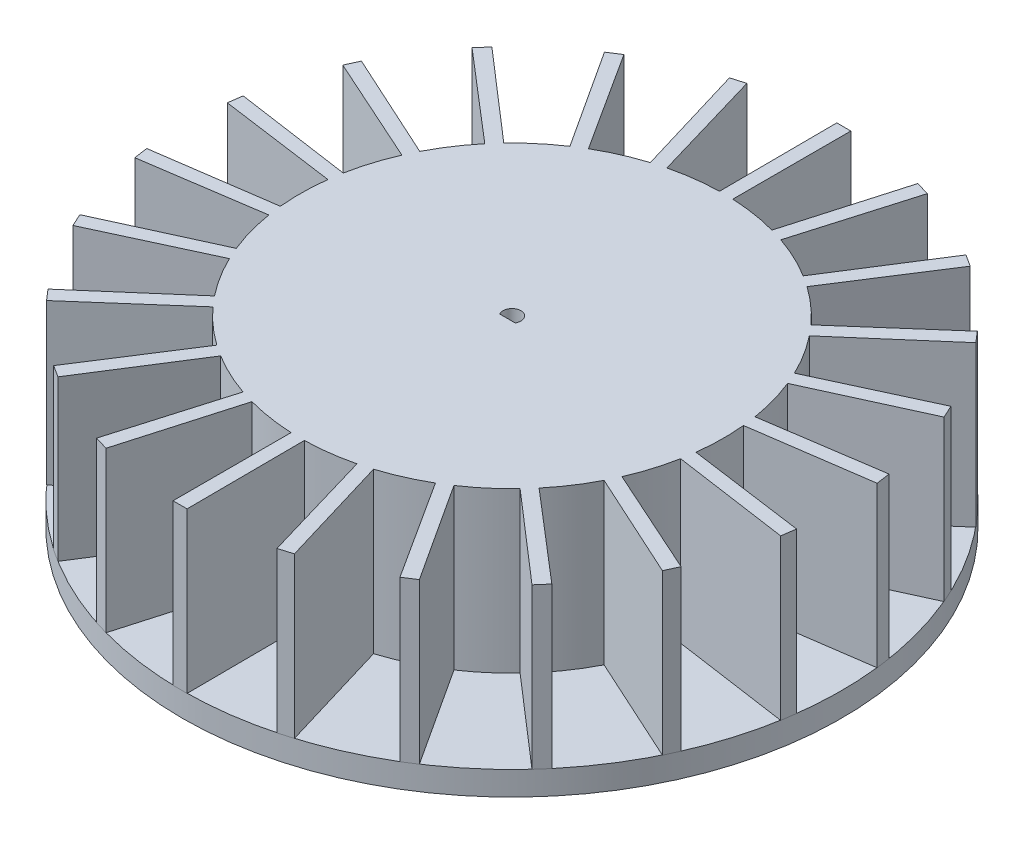
from build123d import *

# Parameters (mm, degrees)
SKETCH1_R           = 82.5
BOSS_EXTRUDE1_DEPTH = 6
BOSS_EXTRUDE3_DEPTH = 40
SKETCH14_R          = 36
CUT_EXTRUDE1_DEPTH  = 36
CUT_EXTRUDE2_DEPTH  = 36


with BuildPart() as part:
    # Sketch1 → Boss-Extrude1 (new body)
    with BuildSketch(Plane(origin=(0, 0, 0), x_dir=(1, 0, 0), z_dir=(0, 1, 0))):
        Circle(SKETCH1_R)
    extrude(amount=BOSS_EXTRUDE1_DEPTH)


with BuildPart() as body_2:
    # Sketch2 → Boss-Extrude3 (new body)
    with BuildSketch(Plane(origin=(0, 6, 0), x_dir=(1, 0, 0), z_dir=(0, 1, 0))):
        with BuildLine():
            Line((-25.48785652, -78.499002166), (-22.108464136, -79.4912813))
            Line((-22.108464136, -79.4912813), (-13.945902175, -51.132297157))
            ThreePointArc((-13.945902175, -51.132297157), (-8.193269273, -52.362871757), (-2.339694653, -52.948331692))
            Line((-2.339694653, -52.948331692), (-2.339694653, -82.5))
            Line((-2.339694653, -82.5), (1.182365931, -82.5))
            Line((1.182365931, -82.5), (1.024637667, -52.990094524))
            ThreePointArc((1.024637667, -52.990094524), (6.890941446, -52.55011823), (12.672348288, -51.46272038))
            Line((12.672348288, -51.46272038), (20.998015359, -79.81733848))
            Line((20.998015359, -79.81733848), (24.377407743, -78.825059346))
            Line((24.377407743, -78.825059346), (15.91216746, -50.554949577))
            ThreePointArc((15.91216746, -50.554949577), (21.41688907, -48.480066652), (26.657752936, -45.807905523))
            Line((26.657752936, -45.807905523), (42.634591047, -70.668350889))
            Line((42.634591047, -70.668350889), (45.597536957, -68.764181175))
            Line((45.597536957, -68.764181175), (29.510588078, -44.024143277))
            ThreePointArc((29.510588078, -44.024143277), (34.207767713, -40.482448396), (38.483504981, -36.442006591))
            Line((38.483504981, -36.442006591), (60.817165726, -55.794233789))
            Line((60.817165726, -55.794233789), (63.123624906, -53.132438001))
            Line((63.123624906, -53.132438001), (40.718236356, -33.926762711))
            ThreePointArc((40.718236356, -33.926762711), (44.227336457, -29.205182929), (47.191552323, -24.123793014))
            Line((47.191552323, -24.123793014), (74.072695332, -36.399999689))
            Line((74.072695332, -36.399999689), (75.535812176, -33.196220691))
            Line((75.535812176, -33.196220691), (48.627135286, -21.0808376))
            ThreePointArc((48.627135286, -21.0808376), (50.663869432, -15.561887231), (52.076420754, -9.851213197))
            Line((52.076420754, -9.851213197), (81.327295689, -14.056854093))
            Line((81.327295689, -14.056854093), (81.828537171, -10.570643006))
            Line((81.828537171, -10.570643006), (52.596552911, -6.527068399))
            ThreePointArc((52.596552911, -6.527068399), (52.995917015, -0.65785998), (52.742367286, 5.219453326))
            Line((52.742367286, 5.219453326), (81.993242221, 9.425094222))
            Line((81.993242221, 9.425094222), (81.492000739, 12.911305309))
            Line((81.492000739, 12.911305309), (52.304910623, 8.555485065))
            ThreePointArc((52.304910623, 8.555485065), (51.03455058, 14.299463175), (49.135440892, 19.867270782))
            Line((49.135440892, 19.867270782), (76.016583902, 32.143477457))
            Line((76.016583902, 32.143477457), (74.553467058, 35.347256454))
            Line((74.553467058, 35.347256454), (47.775835546, 22.944924011))
            ThreePointArc((47.775835546, 22.944924011), (44.938668372, 28.098328865), (41.547853297, 32.905560114))
            Line((41.547853297, 32.905560114), (63.881514042, 52.257787312))
            Line((63.881514042, 52.257787312), (61.575054863, 54.9195831))
            Line((61.575054863, 54.9195831), (39.376246407, 35.475501673))
            ThreePointArc((39.376246407, 35.475501673), (35.202122512, 39.620835057), (30.594305722, 43.278036663))
            Line((30.594305722, 43.278036663), (46.571143833, 68.138482029))
            Line((46.571143833, 68.138482029), (43.608197923, 70.042651742))
            Line((43.608197923, 70.042651742), (27.786627963, 45.132065169))
            ThreePointArc((27.786627963, 45.132065169), (22.613710042, 47.933496828), (17.162189448, 50.144384066))
            Line((17.162189448, 50.144384066), (25.48785652, 78.499002166))
            Line((25.48785652, 78.499002166), (22.108464136, 79.4912813))
            Line((22.108464136, 79.4912813), (13.945902175, 51.132297157))
            ThreePointArc((13.945902175, 51.132297157), (8.193269273, 52.362871757), (2.339694653, 52.948331692))
            Line((2.339694653, 52.948331692), (2.339694653, 82.5))
            Line((2.339694653, 82.5), (-1.182365931, 82.5))
            Line((-1.182365931, 82.5), (-1.024637667, 52.990094524))
            ThreePointArc((-1.024637667, 52.990094524), (-6.890941446, 52.55011823), (-12.672348288, 51.46272038))
            Line((-12.672348288, 51.46272038), (-20.998015359, 79.81733848))
            Line((-20.998015359, 79.81733848), (-24.377407743, 78.825059346))
            Line((-24.377407743, 78.825059346), (-15.91216746, 50.554949577))
            ThreePointArc((-15.91216746, 50.554949577), (-21.41688907, 48.480066652), (-26.657752936, 45.807905523))
            Line((-26.657752936, 45.807905523), (-42.634591047, 70.668350889))
            Line((-42.634591047, 70.668350889), (-45.597536957, 68.764181175))
            Line((-45.597536957, 68.764181175), (-29.510588078, 44.024143277))
            ThreePointArc((-29.510588078, 44.024143277), (-34.207767713, 40.482448396), (-38.483504981, 36.442006591))
            Line((-38.483504981, 36.442006591), (-60.817165726, 55.794233789))
            Line((-60.817165726, 55.794233789), (-63.123624906, 53.132438001))
            Line((-63.123624906, 53.132438001), (-40.718236356, 33.926762711))
            ThreePointArc((-40.718236356, 33.926762711), (-44.227336457, 29.205182929), (-47.191552323, 24.123793014))
            Line((-47.191552323, 24.123793014), (-74.072695332, 36.399999689))
            Line((-74.072695332, 36.399999689), (-75.535812176, 33.196220691))
            Line((-75.535812176, 33.196220691), (-48.627135286, 21.0808376))
            ThreePointArc((-48.627135286, 21.0808376), (-50.663869432, 15.561887231), (-52.076420754, 9.851213197))
            Line((-52.076420754, 9.851213197), (-81.327295689, 14.056854093))
            Line((-81.327295689, 14.056854093), (-81.828537171, 10.570643006))
            Line((-81.828537171, 10.570643006), (-52.596552911, 6.527068399))
            ThreePointArc((-52.596552911, 6.527068399), (-52.995917015, 0.65785998), (-52.742367286, -5.219453326))
            Line((-52.742367286, -5.219453326), (-81.993242221, -9.425094222))
            Line((-81.993242221, -9.425094222), (-81.492000739, -12.911305309))
            Line((-81.492000739, -12.911305309), (-52.304910623, -8.555485065))
            ThreePointArc((-52.304910623, -8.555485065), (-51.03455058, -14.299463175), (-49.135440892, -19.867270782))
            Line((-49.135440892, -19.867270782), (-76.016583902, -32.143477457))
            Line((-76.016583902, -32.143477457), (-74.553467058, -35.347256454))
            Line((-74.553467058, -35.347256454), (-47.775835546, -22.944924011))
            ThreePointArc((-47.775835546, -22.944924011), (-44.938668372, -28.098328865), (-41.547853297, -32.905560114))
            Line((-41.547853297, -32.905560114), (-63.881514042, -52.257787312))
            Line((-63.881514042, -52.257787312), (-61.575054863, -54.9195831))
            Line((-61.575054863, -54.9195831), (-39.376246407, -35.475501673))
            ThreePointArc((-39.376246407, -35.475501673), (-35.202122512, -39.620835057), (-30.594305722, -43.278036663))
            Line((-30.594305722, -43.278036663), (-46.571143833, -68.138482029))
            Line((-46.571143833, -68.138482029), (-43.608197923, -70.042651742))
            Line((-43.608197923, -70.042651742), (-27.786627963, -45.132065169))
            ThreePointArc((-27.786627963, -45.132065169), (-22.613710042, -47.933496828), (-17.162189448, -50.144384066))
            Line((-17.162189448, -50.144384066), (-25.48785652, -78.499002166))
        make_face()
    extrude(amount=BOSS_EXTRUDE3_DEPTH)


with BuildPart() as cut_extrude1_tool:
    # Sketch14 → Cut-Extrude1 (new body)
    with BuildSketch(Plane.XZ):
        Circle(SKETCH14_R)
    extrude(amount=-CUT_EXTRUDE1_DEPTH)


with BuildPart() as part_1:
    add(part.part)

    # Cut-Extrude1: cut by cut_extrude1_tool
    add(cut_extrude1_tool.part, mode=Mode.SUBTRACT)


with BuildPart() as body_2_1:
    add(body_2.part)

    # Cut-Extrude1: cut by cut_extrude1_tool
    add(cut_extrude1_tool.part, mode=Mode.SUBTRACT)

    # Sketch15 → Cut-Extrude2 (cut)
    with BuildSketch(Plane(origin=(0, 46, 0), x_dir=(1, 0, 0), z_dir=(0, 1, 0))):
        with BuildLine():
            Line((-1.948557159, -1.125), (1.948557159, -1.125))
            ThreePointArc((1.948557159, -1.125), (0, 2.25), (-1.948557159, -1.125))
        make_face()
    extrude(amount=-CUT_EXTRUDE2_DEPTH, mode=Mode.SUBTRACT)


solid = Compound([part_1.part, body_2_1.part])
